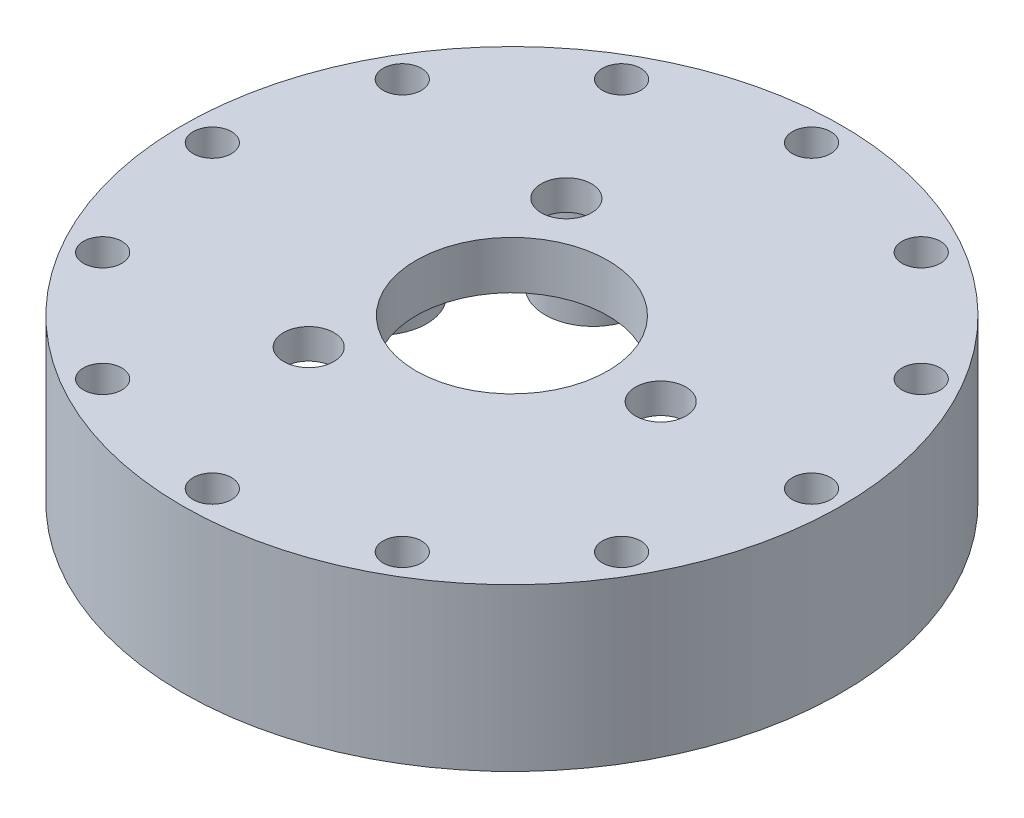
from build123d import *

# Parameters (mm, degrees)
SKETCH1_R           = 27.5
BOSS_EXTRUDE2_DEPTH = 9.5
SKETCH2_R           = 27.5
SKETCH2_R_2         = 8
SKETCH2_R_3         = 2.1
BOSS_EXTRUDE3_DEPTH = 4
FILLET2_R           = 1
SKETCH8_R           = 1.6
CUT_EXTRUDE1_DEPTH  = 42.167341559
SKETCH9_R           = 4.25
CUT_EXTRUDE2_DEPTH  = 1.5


with BuildPart() as part:
    # Sketch1 → Boss-Extrude2 (new body)
    with BuildSketch(Plane(origin=(0, 0, 0), x_dir=(1, 0, 0), z_dir=(0, 1, 0))):
        Circle(SKETCH1_R)
        with BuildLine():
            ThreePointArc((22.486051897, 0.792130095), (18.311696675, -2.632824508), (21.352039962, -7.095096155))
            ThreePointArc((21.352039962, -7.095096155), (20.466719895, -9.346837793), (19.34472846, -11.490495238))
            ThreePointArc((19.34472846, -11.490495238), (13.981367126, -12.114923578), (14.126580466, -17.512559046))
            ThreePointArc((14.126580466, -17.512559046), (12.164418393, -18.928204489), (10.06159042, -20.124969521))
            ThreePointArc((10.06159042, -20.124969521), (5.212052302, -17.750620012), (2.416031486, -22.369908177))
            ThreePointArc((2.416031486, -22.369908177), (0, -22.5), (-2.416031486, -22.369908177))
            ThreePointArc((-2.416031486, -22.369908177), (-5.212052302, -17.750620012), (-10.06159042, -20.124969521))
            ThreePointArc((-10.06159042, -20.124969521), (-12.164418393, -18.928204489), (-14.126580466, -17.512559046))
            ThreePointArc((-14.126580466, -17.512559046), (-13.981367126, -12.114923578), (-19.34472846, -11.490495238))
            ThreePointArc((-19.34472846, -11.490495238), (-20.466719895, -9.346837793), (-21.352039962, -7.095096155))
            ThreePointArc((-21.352039962, -7.095096155), (-18.311696675, -2.632824508), (-22.486051897, 0.792130095))
            ThreePointArc((-22.486051897, 0.792130095), (-22.270982442, 3.202083861), (-21.798377637, 5.575009634))
            ThreePointArc((-21.798377637, 5.575009634), (-16.828191914, 7.685177741), (-18.488212735, 12.82325972))
            ThreePointArc((-18.488212735, 12.82325972), (-17.004365423, 14.734366514), (-15.323884431, 16.475089254))
            ThreePointArc((-15.323884431, 16.475089254), (-10.001855123, 15.563190357), (-8.620496662, 20.783094988))
            ThreePointArc((-8.620496662, 20.783094988), (-6.338982529, 21.588591906), (-3.984166192, 22.144444444))
            ThreePointArc((-3.984166192, 22.144444444), (0, 18.5), (3.984166192, 22.144444444))
            ThreePointArc((3.984166192, 22.144444444), (6.338982529, 21.588591906), (8.620496662, 20.783094988))
            ThreePointArc((8.620496662, 20.783094988), (10.001855123, 15.563190357), (15.323884431, 16.475089254))
            ThreePointArc((15.323884431, 16.475089254), (17.004365423, 14.734366514), (18.488212735, 12.82325972))
            ThreePointArc((18.488212735, 12.82325972), (16.828191914, 7.685177741), (21.798377637, 5.575009634))
            ThreePointArc((21.798377637, 5.575009634), (22.270982442, 3.202083861), (22.486051897, 0.792130095))
        make_face(mode=Mode.SUBTRACT)
    extrude(amount=BOSS_EXTRUDE2_DEPTH)

    # Sketch2 → Boss-Extrude3 (add)
    with BuildSketch(Plane(origin=(0, 9.5, 0), x_dir=(1, 0, 0), z_dir=(0, 1, 0))):
        Circle(SKETCH2_R)
        Circle(SKETCH2_R_2, mode=Mode.SUBTRACT)
        with Locations((-6.206515394, 10.75)):
            Circle(SKETCH2_R_3, mode=Mode.SUBTRACT)
        with Locations((12.413030788, 0)):
            Circle(SKETCH2_R_3, mode=Mode.SUBTRACT)
        with Locations((-6.206515394, -10.75)):
            Circle(SKETCH2_R_3, mode=Mode.SUBTRACT)
    extrude(amount=BOSS_EXTRUDE3_DEPTH)

    # Fillet2
    fillet2_edges = [part.edges().sort_by_distance(p)[0] for p in [
        (19.34472846, 4.75, 11.490495238),
        (10.06159042, 4.75, 20.124969521),
        (2.416031486, 4.75, 22.369908177),
        (14.126580466, 4.75, 17.512559046),
        (-2.416031486, 4.75, 22.369908177),
        (-10.06159042, 4.75, 20.124969521),
        (-14.126580466, 4.75, 17.512559046),
        (-19.34472846, 4.75, 11.490495238),
        (-21.352039962, 4.75, 7.095096155),
        (-22.486051897, 4.75, -0.792130095),
        (-21.798377637, 4.75, -5.575009634),
        (-18.488212735, 4.75, -12.82325972),
        (-15.323884431, 4.75, -16.475089254),
        (-8.620496662, 4.75, -20.783094988),
        (-3.984166192, 4.75, -22.144444444),
        (3.984166192, 4.75, -22.144444444),
        (8.620496662, 4.75, -20.783094988),
        (15.323884431, 4.75, -16.475089254),
        (18.488212735, 4.75, -12.82325972),
        (21.798377637, 4.75, -5.575009634),
        (22.486051897, 4.75, -0.792130095),
        (21.352039962, 4.75, 7.095096155),
    ]]
    fillet(fillet2_edges, radius=FILLET2_R)

    # Sketch8 → Cut-Extrude1 (cut, through all)
    with BuildSketch(Plane.XZ):
        with Locations((0, -25)):
            Circle(SKETCH8_R)
        with Locations((-12.5, -21.650635095)):
            Circle(SKETCH8_R)
        with Locations((-21.650635095, -12.5)):
            Circle(SKETCH8_R)
        with Locations((-25, 0)):
            Circle(SKETCH8_R)
        with Locations((-21.650635095, 12.5)):
            Circle(SKETCH8_R)
        with Locations((-12.5, 21.650635095)):
            Circle(SKETCH8_R)
        with Locations((0, 25)):
            Circle(SKETCH8_R)
        with Locations((12.5, 21.650635095)):
            Circle(SKETCH8_R)
        with Locations((21.650635095, 12.5)):
            Circle(SKETCH8_R)
        with Locations((25, 0)):
            Circle(SKETCH8_R)
        with Locations((21.650635095, -12.5)):
            Circle(SKETCH8_R)
        with Locations((12.5, -21.650635095)):
            Circle(SKETCH8_R)
    extrude(amount=-CUT_EXTRUDE1_DEPTH, mode=Mode.SUBTRACT)

    # Sketch9 → Cut-Extrude2 (cut)
    with BuildSketch(Plane.XZ.offset(-9.5)):
        with Locations((12.413030788, 0)):
            Circle(SKETCH9_R)
        with Locations((-6.206515394, -10.75)):
            Circle(SKETCH9_R)
        with Locations((-6.206515394, 10.75)):
            Circle(SKETCH9_R)
    extrude(amount=-CUT_EXTRUDE2_DEPTH, mode=Mode.SUBTRACT)


solid = part.part
